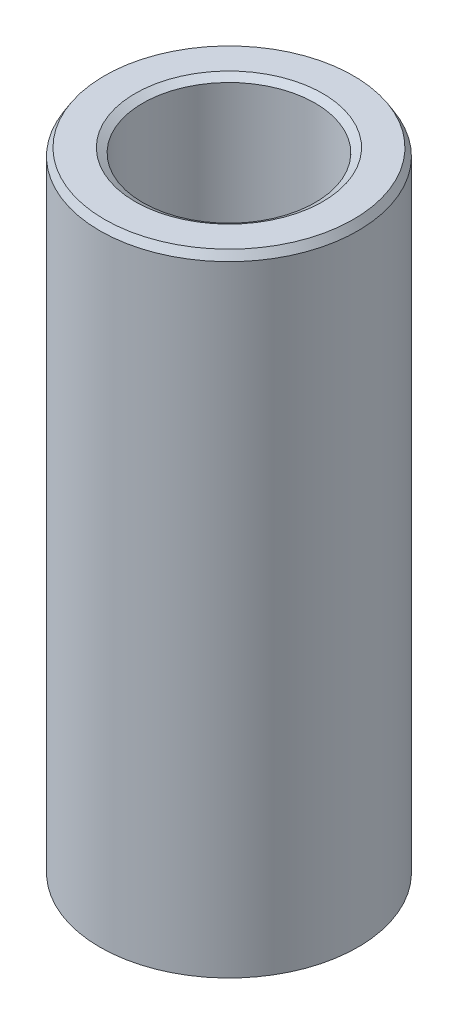
from build123d import *
from OCP.BRepFilletAPI import BRepFilletAPI_MakeChamfer

# Parameters (mm, degrees)
SKETCH1_R           = 60
BOSS_EXTRUDE1_DEPTH = 294.108973791
SKETCH2_R           = 40.076272752
CUT_EXTRUDE1_DEPTH  = 307.1047018
CHAMFER1_SIZE       = 3.526185906
CHAMFER1_SIZE2      = 2.12950079


with BuildPart() as part:
    # Sketch1 → Boss-Extrude1 (new body)
    with BuildSketch(Plane(origin=(0, 0, 0), x_dir=(1, 0, 0), z_dir=(0, 1, 0))):
        Circle(SKETCH1_R)
    extrude(amount=BOSS_EXTRUDE1_DEPTH)

    # Sketch2 → Cut-Extrude1 (cut, through all)
    with BuildSketch(Plane(origin=(0, 0, 0), x_dir=(1, 0, 0), z_dir=(0, 1, 0))):
        Circle(SKETCH2_R)
    extrude(amount=CUT_EXTRUDE1_DEPTH, mode=Mode.SUBTRACT)

    # Chamfer1: one chamfer whose edges measure the first distance from different faces: ONE call of the kernel's chamfer builder (chamfer() names one face for all edges)
    chamfer1_edges_1 = [part.edges().sort_by_distance(p)[0] for p in [
        (-40.076272752, 294.108973791, 0),
    ]]
    chamfer1_side_1 = [part.faces().sort_by_distance(p)[0] for p in [
        (-58.302943725, 294.108973791, 0),
    ]]
    chamfer1_edges_2 = [part.edges().sort_by_distance(p)[0] for p in [
        (-40.076272752, 0, 0),
    ]]
    chamfer1_side_2 = [part.faces().sort_by_distance(p)[0] for p in [
        (-40.076272752, 147.054486895, 0),
    ]]
    chamfer1_edges_3 = [part.edges().sort_by_distance(p)[0] for p in [
        (-60, 0, 0),
    ]]
    chamfer1_side_3 = [part.faces().sort_by_distance(p)[0] for p in [
        (-58.302943725, 0, 0),
    ]]
    chamfer1_edges_4 = [part.edges().sort_by_distance(p)[0] for p in [
        (-60, 294.108973791, 0),
    ]]
    chamfer1_side_4 = [part.faces().sort_by_distance(p)[0] for p in [
        (-60, 147.054486895, 0),
    ]]
    chamfer1 = BRepFilletAPI_MakeChamfer(part.part.solid().wrapped)
    for e in chamfer1_edges_1:
        chamfer1.Add(CHAMFER1_SIZE, CHAMFER1_SIZE2, e.wrapped, chamfer1_side_1[0].wrapped)  # the first distance lies on this face
    for e in chamfer1_edges_2:
        chamfer1.Add(CHAMFER1_SIZE, CHAMFER1_SIZE2, e.wrapped, chamfer1_side_2[0].wrapped)  # the first distance lies on this face
    for e in chamfer1_edges_3:
        chamfer1.Add(CHAMFER1_SIZE, CHAMFER1_SIZE2, e.wrapped, chamfer1_side_3[0].wrapped)  # the first distance lies on this face
    for e in chamfer1_edges_4:
        chamfer1.Add(CHAMFER1_SIZE, CHAMFER1_SIZE2, e.wrapped, chamfer1_side_4[0].wrapped)  # the first distance lies on this face
    add(Compound.cast(chamfer1.Shape()), mode=Mode.REPLACE)


solid = part.part
